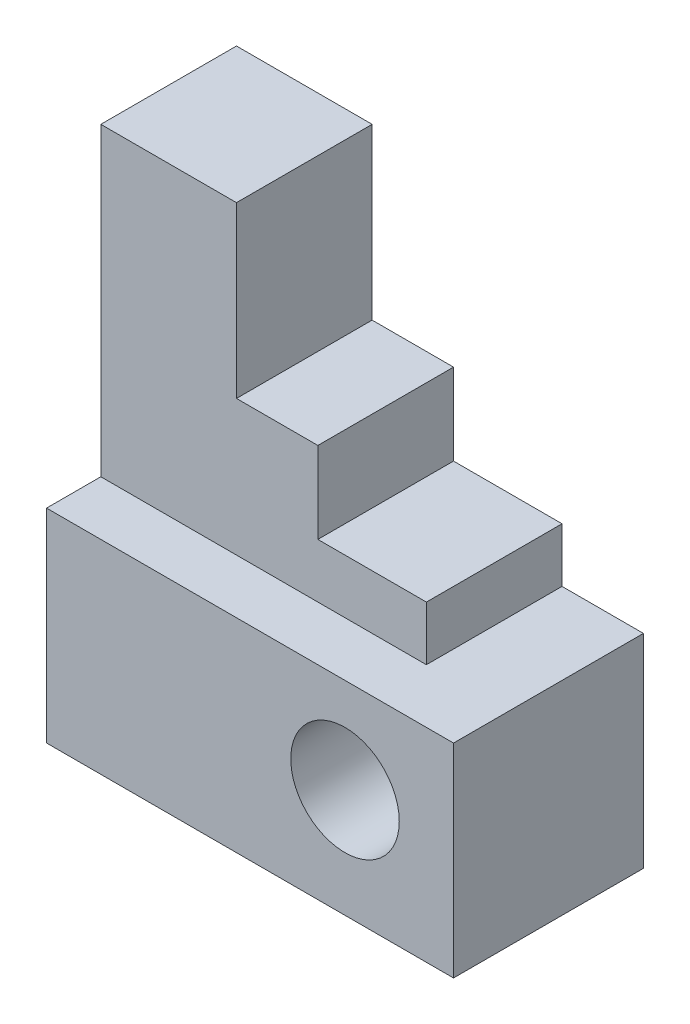
from build123d import *

# Parameters (mm, degrees)
SKETCH1_W           = 60
SKETCH1_H           = 30
SKETCH1_R           = 8
BOSS_EXTRUDE1_DEPTH = 28
BOSS_EXTRUDE2_DEPTH = 20


with BuildPart() as part:
    # Sketch1 → Boss-Extrude1 (new body)
    with BuildSketch(Plane.XY):
        with Locations((30, 15)):
            Rectangle(SKETCH1_W, SKETCH1_H)
        with Locations((44, 16)):
            Circle(SKETCH1_R, mode=Mode.SUBTRACT)
    extrude(amount=BOSS_EXTRUDE1_DEPTH)

    # Sketch2 → Boss-Extrude2 (add)
    with BuildSketch(Plane.XY):
        Polygon((0, 30), (0, 75), (20, 75), (20, 50), (32, 50), (32, 38), (48, 38), (48, 30), align=None)
    extrude(amount=BOSS_EXTRUDE2_DEPTH)


solid = part.part
